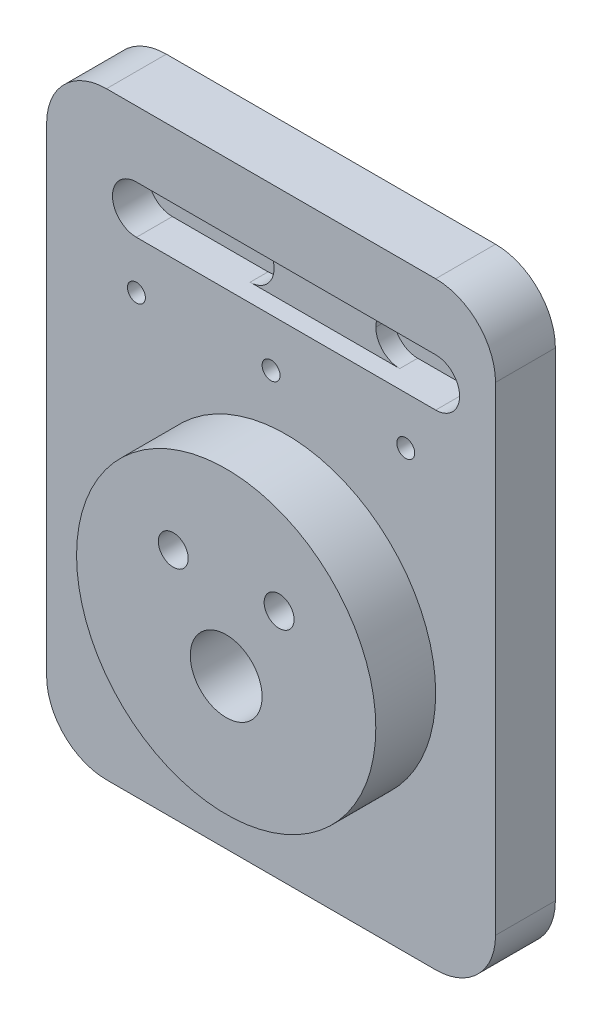
from build123d import *

# Parameters (mm, degrees)
SKETCH2_W                    = 75
SKETCH2_H                    = 100
BOSS_EXTRUDE1_DEPTH          = 10
SKETCH5_R                    = 25
BOSS_EXTRUDE4_DEPTH          = 10
F_5_0_5_DIAMETER_HOLE1_D     = 5
F_12_0_12_DIAMETER_HOLE1_D   = 12
CUT_EXTRUDE1_DEPTH           = 6
FILLET1_R                    = 10
F_3_0_3_DIAMETER_HOLE1_D     = 3
F_3_0_3_DIAMETER_HOLE1_DEPTH = 10
F_3_0_3_DIAMETER_HOLE1_TIP   = 0.901290929
SKETCH18_W                   = 17
SKETCH18_H                   = 8
BOSS_EXTRUDE5_DEPTH          = 3
FILLET2_R                    = 4


with BuildPart() as part:
    # Sketch2 → Boss-Extrude1 (new body)
    with BuildSketch(Plane.XY):
        with Locations((37.5, 50)):
            Rectangle(SKETCH2_W, SKETCH2_H)
    extrude(amount=BOSS_EXTRUDE1_DEPTH)

    # Sketch5 → Boss-Extrude4 (add)
    with BuildSketch(Plane.XY.offset(10)):
        with Locations((40, 40)):
            Circle(SKETCH5_R)
    extrude(amount=BOSS_EXTRUDE4_DEPTH)

    # Ø5.0 (5) Diameter Hole1 (through all)
    with Locations(Plane.XY.offset(20)):
        with Locations((31.161165235, 48.838834765), (48.838834765, 48.838834765)):
            Hole(F_5_0_5_DIAMETER_HOLE1_D / 2)

    # Ø12.0 (12) Diameter Hole1 (through all)
    with Locations(Plane.XY.offset(20)):
        with Locations((40, 35)):
            Hole(F_12_0_12_DIAMETER_HOLE1_D / 2)

    # Sketch12 → Cut-Extrude1 (cut)
    with BuildSketch(Plane.XY.offset(10)):
        with BuildLine():
            Line((15, 89), (65, 89))
            ThreePointArc((65, 89), (69, 85), (65, 81))
            Line((65, 81), (15, 81))
            ThreePointArc((15, 81), (11, 85), (15, 89))
        make_face()
    extrude(amount=-CUT_EXTRUDE1_DEPTH, mode=Mode.SUBTRACT)

    # Fillet1
    fillet1_edges = [part.edges().sort_by_distance(p)[0] for p in [
        (0, 100, 5),
        (75, 100, 5),
        (75, 0, 5),
        (0, 0, 5),
    ]]
    fillet(fillet1_edges, radius=FILLET1_R)

    # Ø3.0 (3) Diameter Hole1
    with Locations(Plane.XY.offset(10)):
        with Locations((15, 73), (37.5, 73), (60, 73)):
            Hole(F_3_0_3_DIAMETER_HOLE1_D / 2, depth=F_3_0_3_DIAMETER_HOLE1_DEPTH)
            with Locations((0, 0, -(F_3_0_3_DIAMETER_HOLE1_DEPTH + F_3_0_3_DIAMETER_HOLE1_TIP / 2))):  # 118° drill point
                Cone(0, F_3_0_3_DIAMETER_HOLE1_D / 2, F_3_0_3_DIAMETER_HOLE1_TIP, mode=Mode.SUBTRACT)

    # Sketch18 → Boss-Extrude5 (add)
    with BuildSketch(Plane.XY.offset(4)):
        with Locations((43.5, 85)):
            Rectangle(SKETCH18_W, SKETCH18_H)
    extrude(amount=BOSS_EXTRUDE5_DEPTH)

    # Fillet2
    fillet2_edges = [part.edges().sort_by_distance(p)[0] for p in [
        (52, 81, 5.5),
        (52, 89, 5.5),
        (35, 81, 5.5),
        (35, 89, 5.5),
    ]]
    fillet(fillet2_edges, radius=FILLET2_R - 0.0001)  # a hair under: the kernel refuses the full size


solid = part.part
